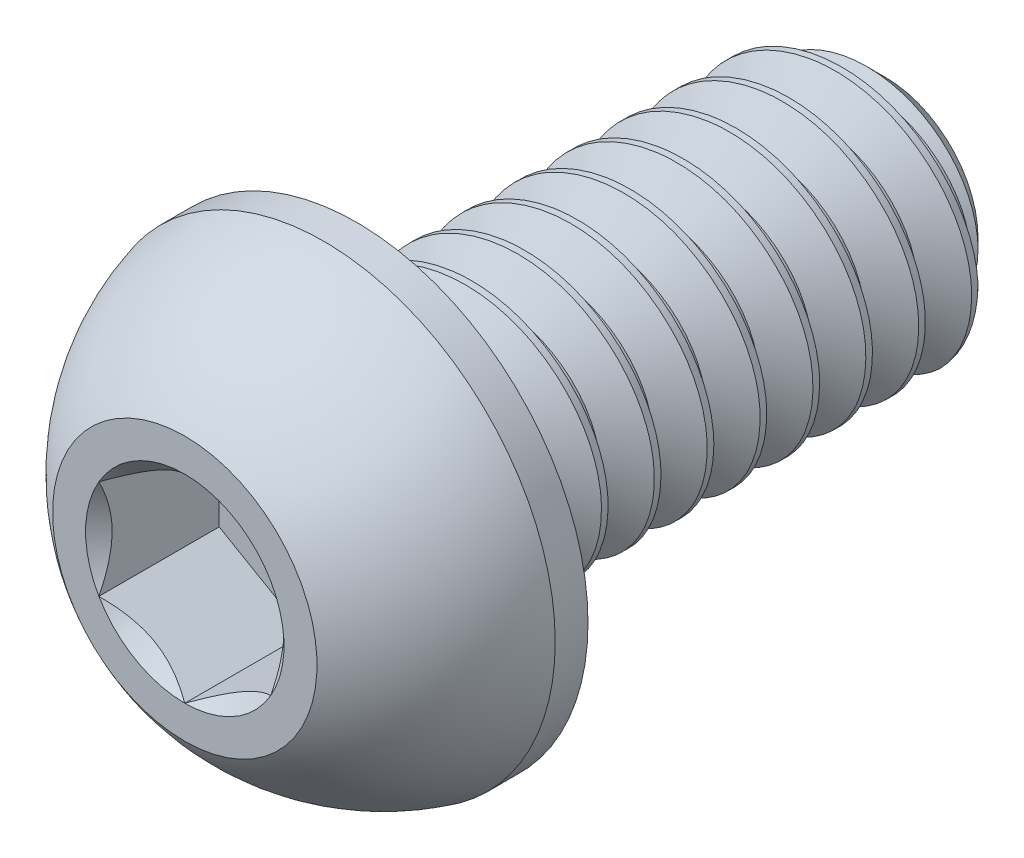
from build123d import *

# Parameters (mm, degrees)
SHAFT_SKETCH_R         = 1
SHAFT_EXTRUDE_DEPTH    = 4
TIP_CHAMFER_SIZE       = 0.3
THREAD_CUT_SWEEP_PITCH = 0.4
HEX_CUT_EXTRUDE_DEPTH  = 0.91


with BuildPart() as part:
    # Shaft Sketch → Shaft Extrude (new body)
    with BuildSketch(Plane(origin=(0, 0, -1.3), x_dir=(-1, 0, 0), z_dir=(0, 0, -1))):
        Circle(SHAFT_SKETCH_R)
    extrude(amount=SHAFT_EXTRUDE_DEPTH)

    # Tip Chamfer
    tip_chamfer_edges = [part.edges().sort_by_distance(p)[0] for p in [
        (1, 0, -5.3),
    ]]
    chamfer(tip_chamfer_edges, length=TIP_CHAMFER_SIZE)

    # Thread Cut Sweep: arcs per turn and ends read off the stored shape
    # Thread Cut Sweep: the profile of Sketch2 profile screwed along a right-hand helix through 12 turns, 6 arcs to a turn; built about Z, then put on its axis
    thread_cut_sweep_z = Axis((0, 0, 0), (0, 0, 1))
    thread_cut_sweep_corners = [(1.0003, 0, -0.299826795), (1.0003, 0, -0.650173205), (0.740192379, 0, -0.5), (0.740192379, 0, -0.45)]
    with BuildLine(mode=Mode.PRIVATE) as thread_cut_sweep_profile:
        Line(thread_cut_sweep_corners[0], thread_cut_sweep_corners[1])
        Line(thread_cut_sweep_corners[1], thread_cut_sweep_corners[2])
        Line(thread_cut_sweep_corners[2], thread_cut_sweep_corners[3])
        Line(thread_cut_sweep_corners[3], thread_cut_sweep_corners[0])
    thread_cut_sweep_cap = Face(thread_cut_sweep_profile.wire())
    thread_cut_sweep_turn_angles = [0, 30, 60, 90, 120, 150, 180, 210, 240, 270, 300, 330, 360]
    thread_cut_sweep_turn_weights = [1, 0.8660254037844387, 1, 0.8660254037844387, 1, 0.8660254037844387, 1, 0.8660254037844387, 1, 0.8660254037844387, 1, 0.8660254037844387, 1]
    thread_cut_sweep_turn_rails = [Edge.make_bspline([Vector(p[0], p[1], 0).rotate(thread_cut_sweep_z, thread_cut_sweep_turn_angles[k]) / thread_cut_sweep_turn_weights[k] + Vector(0, 0, p[2] + THREAD_CUT_SWEEP_PITCH * thread_cut_sweep_turn_angles[k] / 360) for k in range(13)], [0, 0, 0, 1, 1, 2, 2, 3, 3, 4, 4, 5, 5, 6, 6, 6], 2, thread_cut_sweep_turn_weights) for p in thread_cut_sweep_corners]
    thread_cut_sweep_turn_sides = [Face.make_surface_from_curves(thread_cut_sweep_turn_rails[p[0]], thread_cut_sweep_turn_rails[p[1]]) for p in [(0, 1), (1, 2), (2, 3), (3, 0)]]
    thread_cut_sweep = Plane(origin=(0, 0, -5.3), x_dir=(-1, 0, 0), z_dir=(0, 0, 1)) * Solid(Shell([*[p.moved(Location((0, 0, THREAD_CUT_SWEEP_PITCH * i))) for i in range(12) for p in thread_cut_sweep_turn_sides], thread_cut_sweep_cap, thread_cut_sweep_cap.rotate(thread_cut_sweep_z, 4320).moved(Location((0, 0, THREAD_CUT_SWEEP_PITCH * 4320 / 360)))]))
    add(thread_cut_sweep, mode=Mode.SUBTRACT)

    # Head Sketch → Head Revolve (revolve)
    with BuildSketch(Plane(origin=(0, 0, 0), x_dir=(0, 0, -1), z_dir=(1, 0, 0)), mode=Mode.PRIVATE) as head_revolve_sk:
        with BuildLine():
            Line((1.052, 1.75), (1.3, 1.75))
            Line((1.3, 1.75), (1.3, 0))
            Line((1.3, 0), (0, 0))
            Line((0, 0), (0, 1))
            ThreePointArc((0, 1), (0.456720817, 1.472175601), (1.052, 1.75))
        make_face()
    revolve(head_revolve_sk.sketch.rotate(Axis((0, 0, 0), (0, 0, -1)), 90), axis=Axis((0, 0, 0), (0, 0, -1)))

    # Sketch5 → Hex Cut Extrude (cut)
    with BuildSketch(Plane.XY):
        Polygon((0.65, -0.375277675), (0.65, 0.375277675), (0, 0.75055535), (-0.65, 0.375277675), (-0.65, -0.375277675), (0, -0.75055535), align=None)
    extrude(amount=-HEX_CUT_EXTRUDE_DEPTH, mode=Mode.SUBTRACT)

    # Hex Entry Cut Extrude cone 1 section (through the dimple's axis) → Hex Entry Cut Extrude (revolve, cut)
    with BuildSketch(Plane(origin=(0, 0, 0), x_dir=(0, -1, 0), z_dir=(1, 0, 0))):
        Polygon((0, 0), (0.75055535, 0), (0, 0.75055535), align=None)
    revolve(axis=Axis((0, 0, 0), (0, 0, -1)), mode=Mode.SUBTRACT)


solid = part.part
